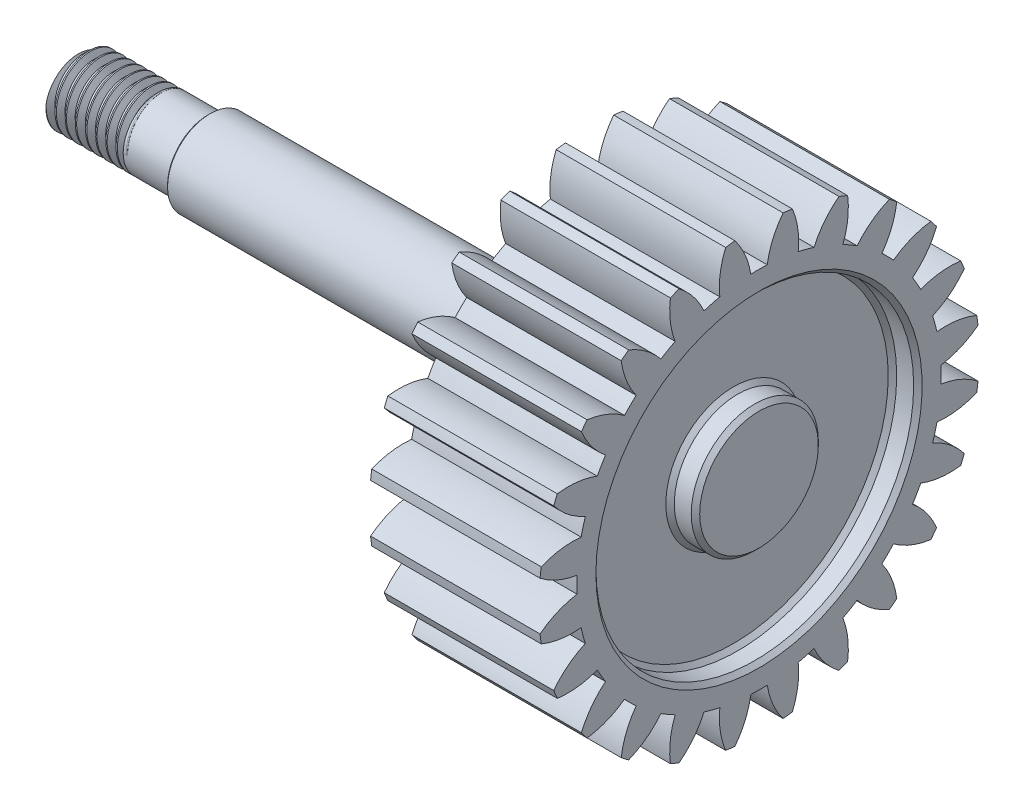
from build123d import *

# Parameters (mm, degrees)
BOSS_EXTRUDE1_START       = -10
BOSS_EXTRUDE1_DEPTH       = 10
BOSS_EXTRUDE1_START_2     = -40.0000508
BOSS_EXTRUDE1_2_OUTLINE_R = 2.5
BOSS_EXTRUDE1_2_DEPTH     = 30.0000508
SKETCH2_R                 = 9.375
SKETCH2_R_2               = 3.75
CUT_EXTRUDE1_DEPTH        = 1.5
CUT_EXTRUDE2_START        = -8.5
SKETCH3_2_R               = 9.375
SKETCH3_2_R_2             = 3.75
CUT_EXTRUDE2_DEPTH        = 1.5
CHAMFER1_SIZE             = 0.25
SKETCH3_OUTSIDE_W         = 38.68
SKETCH3_OUTSIDE_H         = 38.68
SKETCH3_OUTSIDE_R         = 1.75
CUT_EXTRUDE3_DEPTH        = 7.5
THREAD1_PITCH             = 0.6
CUT_EXTRUDE4_DEPTH        = 1
SKETCH10_R                = 2.07
BOSS_EXTRUDE2_DEPTH       = 2.95
CHAMFER2_SIZE             = 0.1


with BuildPart() as part:
    # Boss-Extrude1: read off the stored shape, not the designer's step
    # Boss-Extrude1 outline → Boss-Extrude1 (new body)
    with BuildSketch(Plane(origin=(10, 0, 0), x_dir=(0, 0, -1), z_dir=(1, 0, 0)).offset(BOSS_EXTRUDE1_START)):
        with BuildLine():
            ThreePointArc((-12.849830898, 1.970240061), (-12.888783198, 1.696840499), (-12.921919179, 1.422675204))
            ThreePointArc((-12.921919179, 1.422675204), (-11.889084866, 0.815732219), (-10.738122679, 0.483448384))
            ThreePointArc((-10.738122679, 0.483448384), (-10.749, 0), (-10.738122679, -0.483448384))
            ThreePointArc((-10.738122679, -0.483448384), (-11.889084866, -0.815732219), (-12.921919179, -1.422675204))
            ThreePointArc((-12.921919179, -1.422675204), (-12.888783198, -1.696840499), (-12.849830898, -1.970240061))
            ThreePointArc((-12.849830898, -1.970240061), (-11.695101157, -2.289184775), (-10.49735567, -2.312255378))
            ThreePointArc((-10.49735567, -2.312255378), (-10.382736707, -2.782045916), (-10.247104372, -3.246205938))
            ThreePointArc((-10.247104372, -3.246205938), (-11.272847089, -3.86505841), (-12.113400022, -4.718637505))
            ThreePointArc((-12.113400022, -4.718637505), (-12.010433923, -4.974884621), (-11.902047876, -5.228886722))
            ThreePointArc((-11.902047876, -5.228886722), (-10.704115631, -5.238097609), (-9.541211221, -4.950382757))
            ThreePointArc((-9.541211221, -4.950382757), (-9.308907065, -5.3745), (-9.057762836, -5.787739922))
            ThreePointArc((-9.057762836, -5.787739922), (-9.888383413, -6.650987257), (-10.479372673, -7.693032457))
            ThreePointArc((-10.479372673, -7.693032457), (-10.313593424, -7.913898577), (-10.143159961, -8.131193393))
            ThreePointArc((-10.143159961, -8.131193393), (-8.983662315, -7.830042747), (-7.934848994, -7.251149732))
            ThreePointArc((-7.934848994, -7.251149732), (-7.600690791, -7.600690791), (-7.251149732, -7.934848994))
            ThreePointArc((-7.251149732, -7.934848994), (-7.830042747, -8.983662315), (-8.131193393, -10.143159961))
            ThreePointArc((-8.131193393, -10.143159961), (-7.913898577, -10.313593424), (-7.693032457, -10.479372673))
            ThreePointArc((-7.693032457, -10.479372673), (-6.650987257, -9.888383413), (-5.787739922, -9.057762836))
            ThreePointArc((-5.787739922, -9.057762836), (-5.3745, -9.308907065), (-4.950382757, -9.541211221))
            ThreePointArc((-4.950382757, -9.541211221), (-5.238097609, -10.704115631), (-5.228886722, -11.902047876))
            ThreePointArc((-5.228886722, -11.902047876), (-4.974884621, -12.010433923), (-4.718637505, -12.113400022))
            ThreePointArc((-4.718637505, -12.113400022), (-3.86505841, -11.272847089), (-3.246205938, -10.247104372))
            ThreePointArc((-3.246205938, -10.247104372), (-2.782045916, -10.382736707), (-2.312255378, -10.49735567))
            ThreePointArc((-2.312255378, -10.49735567), (-2.289184775, -11.695101157), (-1.970240061, -12.849830898))
            ThreePointArc((-1.970240061, -12.849830898), (-1.696840499, -12.888783198), (-1.422675204, -12.921919179))
            ThreePointArc((-1.422675204, -12.921919179), (-0.815732219, -11.889084866), (-0.483448384, -10.738122679))
            ThreePointArc((-0.483448384, -10.738122679), (0, -10.749), (0.483448384, -10.738122679))
            ThreePointArc((0.483448384, -10.738122679), (0.815732219, -11.889084866), (1.422675204, -12.921919179))
            ThreePointArc((1.422675204, -12.921919179), (1.696840499, -12.888783198), (1.970240061, -12.849830898))
            ThreePointArc((1.970240061, -12.849830898), (2.289184775, -11.695101157), (2.312255378, -10.49735567))
            ThreePointArc((2.312255378, -10.49735567), (2.782045916, -10.382736707), (3.246205938, -10.247104372))
            ThreePointArc((3.246205938, -10.247104372), (3.86505841, -11.272847089), (4.718637505, -12.113400022))
            ThreePointArc((4.718637505, -12.113400022), (4.974884621, -12.010433923), (5.228886722, -11.902047876))
            ThreePointArc((5.228886722, -11.902047876), (5.238097609, -10.704115631), (4.950382757, -9.541211221))
            ThreePointArc((4.950382757, -9.541211221), (5.3745, -9.308907065), (5.787739922, -9.057762836))
            ThreePointArc((5.787739922, -9.057762836), (6.650987257, -9.888383413), (7.693032457, -10.479372673))
            ThreePointArc((7.693032457, -10.479372673), (7.913898577, -10.313593424), (8.131193393, -10.143159961))
            ThreePointArc((8.131193393, -10.143159961), (7.830042747, -8.983662315), (7.251149732, -7.934848994))
            ThreePointArc((7.251149732, -7.934848994), (7.600690791, -7.600690791), (7.934848994, -7.251149732))
            ThreePointArc((7.934848994, -7.251149732), (8.983662315, -7.830042747), (10.143159961, -8.131193393))
            ThreePointArc((10.143159961, -8.131193393), (10.313593424, -7.913898577), (10.479372673, -7.693032457))
            ThreePointArc((10.479372673, -7.693032457), (9.888383413, -6.650987257), (9.057762836, -5.787739922))
            ThreePointArc((9.057762836, -5.787739922), (9.308907065, -5.3745), (9.541211221, -4.950382757))
            ThreePointArc((9.541211221, -4.950382757), (10.704115631, -5.238097609), (11.902047876, -5.228886722))
            ThreePointArc((11.902047876, -5.228886722), (12.010433923, -4.974884621), (12.113400022, -4.718637505))
            ThreePointArc((12.113400022, -4.718637505), (11.272847089, -3.86505841), (10.247104372, -3.246205938))
            ThreePointArc((10.247104372, -3.246205938), (10.382736707, -2.782045916), (10.49735567, -2.312255378))
            ThreePointArc((10.49735567, -2.312255378), (11.695101157, -2.289184775), (12.849830898, -1.970240061))
            ThreePointArc((12.849830898, -1.970240061), (12.888783198, -1.696840499), (12.921919179, -1.422675204))
            ThreePointArc((12.921919179, -1.422675204), (11.889084866, -0.815732219), (10.738122679, -0.483448384))
            ThreePointArc((10.738122679, -0.483448384), (10.749, 0), (10.738122679, 0.483448384))
            ThreePointArc((10.738122679, 0.483448384), (11.889084866, 0.815732219), (12.921919179, 1.422675204))
            ThreePointArc((12.921919179, 1.422675204), (12.888783198, 1.696840499), (12.849830898, 1.970240061))
            ThreePointArc((12.849830898, 1.970240061), (11.695101157, 2.289184775), (10.49735567, 2.312255378))
            ThreePointArc((10.49735567, 2.312255378), (10.382736707, 2.782045916), (10.247104372, 3.246205938))
            ThreePointArc((10.247104372, 3.246205938), (11.272847089, 3.86505841), (12.113400022, 4.718637505))
            ThreePointArc((12.113400022, 4.718637505), (12.010433923, 4.974884621), (11.902047876, 5.228886722))
            ThreePointArc((11.902047876, 5.228886722), (10.704115631, 5.238097609), (9.541211221, 4.950382757))
            ThreePointArc((9.541211221, 4.950382757), (9.308907065, 5.3745), (9.057762836, 5.787739922))
            ThreePointArc((9.057762836, 5.787739922), (9.888383413, 6.650987257), (10.479372673, 7.693032457))
            ThreePointArc((10.479372673, 7.693032457), (10.313593424, 7.913898577), (10.143159961, 8.131193393))
            ThreePointArc((10.143159961, 8.131193393), (8.983662315, 7.830042747), (7.934848994, 7.251149732))
            ThreePointArc((7.934848994, 7.251149732), (7.600690791, 7.600690791), (7.251149732, 7.934848994))
            ThreePointArc((7.251149732, 7.934848994), (7.830042747, 8.983662315), (8.131193393, 10.143159961))
            ThreePointArc((8.131193393, 10.143159961), (7.913898577, 10.313593424), (7.693032457, 10.479372673))
            ThreePointArc((7.693032457, 10.479372673), (6.650987257, 9.888383413), (5.787739922, 9.057762836))
            ThreePointArc((5.787739922, 9.057762836), (5.3745, 9.308907065), (4.950382757, 9.541211221))
            ThreePointArc((4.950382757, 9.541211221), (5.238097609, 10.704115631), (5.228886722, 11.902047876))
            ThreePointArc((5.228886722, 11.902047876), (4.974884621, 12.010433923), (4.718637505, 12.113400022))
            ThreePointArc((4.718637505, 12.113400022), (3.86505841, 11.272847089), (3.246205938, 10.247104372))
            ThreePointArc((3.246205938, 10.247104372), (2.782045916, 10.382736707), (2.312255378, 10.49735567))
            ThreePointArc((2.312255378, 10.49735567), (2.289184775, 11.695101157), (1.970240061, 12.849830898))
            ThreePointArc((1.970240061, 12.849830898), (1.696840499, 12.888783198), (1.422675204, 12.921919179))
            ThreePointArc((1.422675204, 12.921919179), (0.815732219, 11.889084866), (0.483448384, 10.738122679))
            ThreePointArc((0.483448384, 10.738122679), (0, 10.749), (-0.483448384, 10.738122679))
            ThreePointArc((-0.483448384, 10.738122679), (-0.815732219, 11.889084866), (-1.422675204, 12.921919179))
            ThreePointArc((-1.422675204, 12.921919179), (-1.696840499, 12.888783198), (-1.970240061, 12.849830898))
            ThreePointArc((-1.970240061, 12.849830898), (-2.289184775, 11.695101157), (-2.312255378, 10.49735567))
            ThreePointArc((-2.312255378, 10.49735567), (-2.782045916, 10.382736707), (-3.246205938, 10.247104372))
            ThreePointArc((-3.246205938, 10.247104372), (-3.86505841, 11.272847089), (-4.718637505, 12.113400022))
            ThreePointArc((-4.718637505, 12.113400022), (-4.974884621, 12.010433923), (-5.228886722, 11.902047876))
            ThreePointArc((-5.228886722, 11.902047876), (-5.238097609, 10.704115631), (-4.950382757, 9.541211221))
            ThreePointArc((-4.950382757, 9.541211221), (-5.3745, 9.308907065), (-5.787739922, 9.057762836))
            ThreePointArc((-5.787739922, 9.057762836), (-6.650987257, 9.888383413), (-7.693032457, 10.479372673))
            ThreePointArc((-7.693032457, 10.479372673), (-7.913898577, 10.313593424), (-8.131193393, 10.143159961))
            ThreePointArc((-8.131193393, 10.143159961), (-7.830042747, 8.983662315), (-7.251149732, 7.934848994))
            ThreePointArc((-7.251149732, 7.934848994), (-7.600690791, 7.600690791), (-7.934848994, 7.251149732))
            ThreePointArc((-7.934848994, 7.251149732), (-8.983662315, 7.830042747), (-10.143159961, 8.131193393))
            ThreePointArc((-10.143159961, 8.131193393), (-10.313593424, 7.913898577), (-10.479372673, 7.693032457))
            ThreePointArc((-10.479372673, 7.693032457), (-9.888383413, 6.650987257), (-9.057762836, 5.787739922))
            ThreePointArc((-9.057762836, 5.787739922), (-9.308907065, 5.3745), (-9.541211221, 4.950382757))
            ThreePointArc((-9.541211221, 4.950382757), (-10.704115631, 5.238097609), (-11.902047876, 5.228886722))
            ThreePointArc((-11.902047876, 5.228886722), (-12.010433923, 4.974884621), (-12.113400022, 4.718637505))
            ThreePointArc((-12.113400022, 4.718637505), (-11.272847089, 3.86505841), (-10.247104372, 3.246205938))
            ThreePointArc((-10.247104372, 3.246205938), (-10.382736707, 2.782045916), (-10.49735567, 2.312255378))
            ThreePointArc((-10.49735567, 2.312255378), (-11.695101157, 2.289184775), (-12.849830898, 1.970240061))
        make_face()
    extrude(amount=BOSS_EXTRUDE1_DEPTH)

    # Boss-Extrude1 2 outline → Boss-Extrude1 2 (add)
    with BuildSketch(Plane(origin=(10, 0, 0), x_dir=(0, 0, -1), z_dir=(1, 0, 0)).offset(BOSS_EXTRUDE1_START_2)):
        Circle(BOSS_EXTRUDE1_2_OUTLINE_R)
    extrude(amount=BOSS_EXTRUDE1_2_DEPTH)

    # Sketch2 → Cut-Extrude1 (cut)
    with BuildSketch(Plane(origin=(10, 0, 0), x_dir=(0, 0, -1), z_dir=(1, 0, 0))):
        Circle(SKETCH2_R)
        Circle(SKETCH2_R_2, mode=Mode.SUBTRACT)
    extrude(amount=-CUT_EXTRUDE1_DEPTH, mode=Mode.SUBTRACT)

    # Sketch3<2> → Cut-Extrude2 (cut)
    with BuildSketch(Plane(origin=(10, 0, 0), x_dir=(0, 0, -1), z_dir=(1, 0, 0)).offset(CUT_EXTRUDE2_START)):
        Circle(SKETCH3_2_R)
        Circle(SKETCH3_2_R_2, mode=Mode.SUBTRACT)
    extrude(amount=-CUT_EXTRUDE2_DEPTH, mode=Mode.SUBTRACT)

    # Chamfer1
    chamfer1_edges = [part.edges().sort_by_distance(p)[0] for p in [
        (8.5, 0, 9.375),
        (8.5, 0, 3.75),
        (10, 0, 9.375),
        (10, 0, 3.75),
        (1.5, 0, 9.375),
        (0, 0, 3.75),
        (0, 0, 9.375),
        (1.5, 0, 3.75),
    ]]
    chamfer(chamfer1_edges, length=CHAMFER1_SIZE)

    # Sketch3 outside → Cut-Extrude3 (cut)
    with BuildSketch(Plane.ZY.offset(30.0000508)):
        Rectangle(SKETCH3_OUTSIDE_W, SKETCH3_OUTSIDE_H)
        Circle(SKETCH3_OUTSIDE_R, mode=Mode.SUBTRACT)
    extrude(amount=-CUT_EXTRUDE3_DEPTH, mode=Mode.SUBTRACT)

    # Thread1: arcs per turn and ends read off the stored shape
    # Thread1: the profile of Thread Profile1 profile screwed along a right-hand helix through 8.333333 turns, 6 arcs to a turn; built about Z, then put on its axis
    thread1_z = Axis((0, 0, 0), (0, 0, 1))
    thread1_corners = [(1.7497, 0, -0.000173205), (2.074759525, 0, 0.187499999), (2.074759525, 0, 0.262499999), (1.7497, 0, 0.450173203)]
    with BuildLine(mode=Mode.PRIVATE) as thread1_profile:
        Line(thread1_corners[0], thread1_corners[1])
        Line(thread1_corners[1], thread1_corners[2])
        Line(thread1_corners[2], thread1_corners[3])
        Line(thread1_corners[3], thread1_corners[0])
    thread1_cap = Face(thread1_profile.wire())
    thread1_turn_angles = [0, 30, 60, 90, 120, 150, 180, 210, 240, 270, 300, 330, 360]
    thread1_turn_weights = [1, 0.8660254037844387, 1, 0.8660254037844387, 1, 0.8660254037844387, 1, 0.8660254037844387, 1, 0.8660254037844387, 1, 0.8660254037844387, 1]
    thread1_turn_rails = [Edge.make_bspline([Vector(p[0], p[1], 0).rotate(thread1_z, thread1_turn_angles[k]) / thread1_turn_weights[k] + Vector(0, 0, p[2] + THREAD1_PITCH * thread1_turn_angles[k] / 360) for k in range(13)], [0, 0, 0, 1, 1, 2, 2, 3, 3, 4, 4, 5, 5, 6, 6, 6], 2, thread1_turn_weights) for p in thread1_corners]
    thread1_turn_sides = [Face.make_surface_from_curves(thread1_turn_rails[p[0]], thread1_turn_rails[p[1]]) for p in [(0, 1), (1, 2), (2, 3), (3, 0)]]
    thread1_last_angles = [2880, 2910, 2940, 2970, 3000]
    thread1_last_weights = [1, 0.8660254037844387, 1, 0.8660254037844367, 1]
    thread1_last_rails = [Edge.make_bspline([Vector(p[0], p[1], 0).rotate(thread1_z, thread1_last_angles[k]) / thread1_last_weights[k] + Vector(0, 0, p[2] + THREAD1_PITCH * thread1_last_angles[k] / 360) for k in range(5)], [0, 0, 0, 1, 1, 2, 2, 2], 2, thread1_last_weights) for p in thread1_corners]
    thread1_last_sides = [Face.make_surface_from_curves(thread1_last_rails[p[0]], thread1_last_rails[p[1]]) for p in [(0, 1), (1, 2), (2, 3), (3, 0)]]
    thread1 = Plane(origin=(-25.0000508, 0, 0), x_dir=(0, 0, 1), z_dir=(-1, 0, 0)) * Solid(Shell([*[p.moved(Location((0, 0, THREAD1_PITCH * i))) for i in range(8) for p in thread1_turn_sides], *thread1_last_sides, thread1_cap, thread1_cap.rotate(thread1_z, 3000).moved(Location((0, 0, THREAD1_PITCH * 3000 / 360)))]))
    add(thread1)

    # Cut-Extrude4: read off the stored shape, not the designer's step
    # Cut-Extrude4 outline → Cut-Extrude4 (cut)
    with BuildSketch(Plane.ZY.offset(30.0000508)):
        Polygon((-3, 3), (-3, -3), (3, -3), (3, 3), (-1.732050812, 3), align=None)
    extrude(amount=CUT_EXTRUDE4_DEPTH, mode=Mode.SUBTRACT)

    # Sketch10 → Boss-Extrude2 (add)
    with BuildSketch(Plane.ZY.offset(22.5000508)):
        Circle(SKETCH10_R)
    extrude(amount=BOSS_EXTRUDE2_DEPTH)

    # Chamfer2
    chamfer2_edges = [part.edges().sort_by_distance(p)[0] for p in [
        (-22.5000508, 0, 2.5),
    ]]
    chamfer(chamfer2_edges, length=CHAMFER2_SIZE)


solid = part.part
